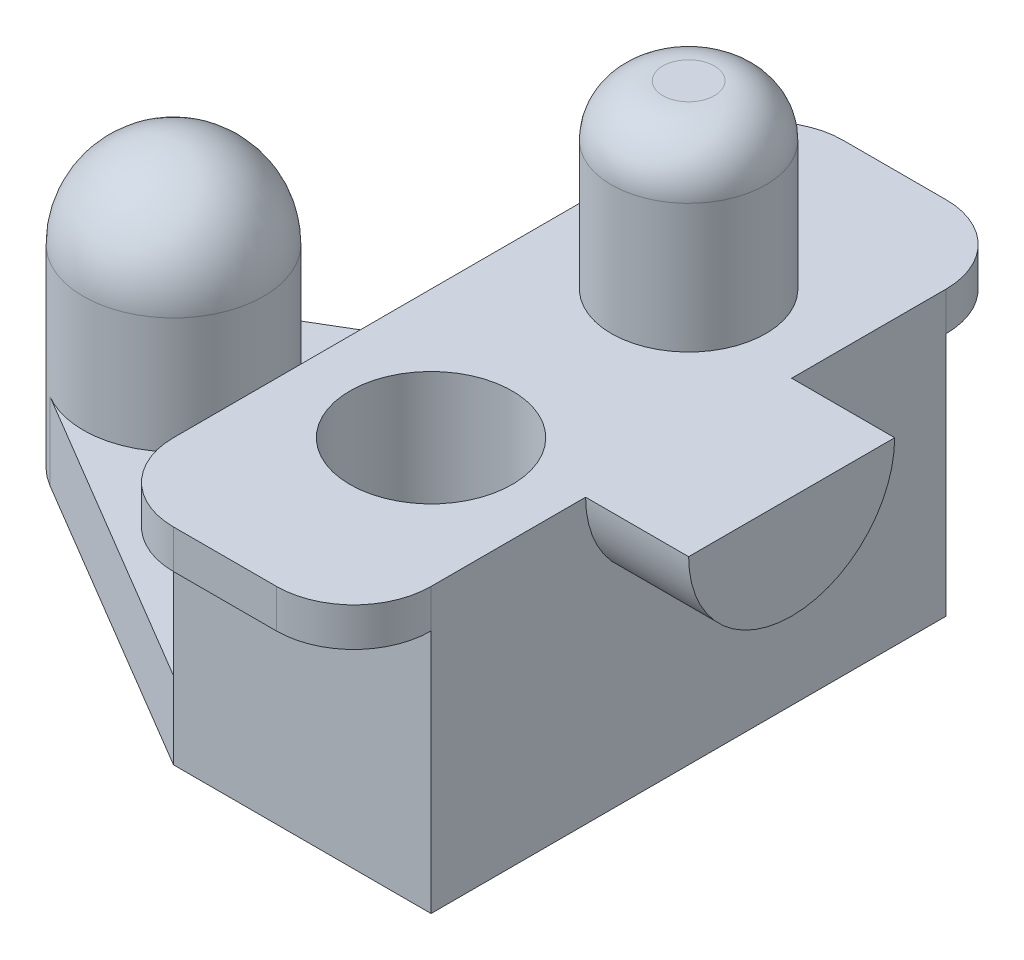
from build123d import *
from build123d.topology import SkipClean

# Parameters (mm, degrees)
BOSS_EXTRUDE1_DEPTH = 1.5
BOSS_EXTRUDE2_START = 4
SKETCH2_R           = 1.75
SKETCH2_W           = 5
SKETCH2_H           = 10
BOSS_EXTRUDE2_DEPTH = 4
BOSS_EXTRUDE3_DEPTH = 0.75
FILLET1_R           = 1.75
SKETCH4_R           = 1.5
BOSS_EXTRUDE4_DEPTH = 3.5
FILLET2_R           = 1
SKETCH5_R           = 1.575
CUT_EXTRUDE1_DEPTH  = 3.75
BOSS_EXTRUDE5_DEPTH = 2


with BuildPart() as part:
    # Sketch1 → Boss-Extrude1 (new body)
    with BuildSketch(Plane(origin=(0, 0, 0), x_dir=(1, 0, 0), z_dir=(0, 1, 0))):
        with BuildLine():
            Line((5, 5), (10, 5))
            Line((10, 5), (10, -5))
            Line((10, -5), (5, -5))
            Line((5, -5), (-0.892692, -1.505192))
            ThreePointArc((-0.892692, -1.505192), (-1.75, 0), (-0.892692, 1.505192))
            Line((-0.892692, 1.505192), (5, 5))
        make_face()
    extrude(amount=-BOSS_EXTRUDE1_DEPTH)

    # Sketch2 → Boss-Extrude2 (add)
    with SkipClean():  # the faces are left unmerged after this step: merging them gives an invalid solid
        with BuildSketch(Plane(origin=(0, 0, 0), x_dir=(1, 0, 0), z_dir=(0, 1, 0)).offset(BOSS_EXTRUDE2_START)):
            Circle(SKETCH2_R)
            with Locations((7.5, 0)):
                Rectangle(SKETCH2_W, SKETCH2_H)
        extrude(amount=-BOSS_EXTRUDE2_DEPTH)

    # Sketch3 → Boss-Extrude3 (add)
    with SkipClean():  # the faces are left unmerged after this step: merging them gives an invalid solid
        with BuildSketch(Plane(origin=(0, 4, 0), x_dir=(1, 0, 0), z_dir=(0, 1, 0))):
            with BuildLine():
                Line((5, 5), (10, 5))
                ThreePointArc((10, 5), (9.56066, 6.06066), (8.5, 6.5))
                Line((8.5, 6.5), (6.5, 6.5))
                ThreePointArc((6.5, 6.5), (5.43934, 6.06066), (5, 5))
            make_face()
            with BuildLine():
                Line((6.5, -6.5), (8.5, -6.5))
                ThreePointArc((8.5, -6.5), (9.56066, -6.06066), (10, -5))
                Line((10, -5), (5, -5))
                ThreePointArc((5, -5), (5.43934, -6.06066), (6.5, -6.5))
            make_face()
        extrude(amount=-BOSS_EXTRUDE3_DEPTH)

    # Fillet1
    fillet1_edges = [part.edges().sort_by_distance(p)[0] for p in [
        (-1.75, 4, 0),
    ]]
    fillet(fillet1_edges, radius=FILLET1_R)

    # Sketch4 → Boss-Extrude4 (add)
    with SkipClean():  # the faces are left unmerged after this step: merging them gives an invalid solid
        with BuildSketch(Plane(origin=(0, 4, 0), x_dir=(1, 0, 0), z_dir=(0, 1, 0))):
            with Locations((7.5, 2.5)):
                Circle(SKETCH4_R)
        extrude(amount=BOSS_EXTRUDE4_DEPTH)

    # Fillet2
    fillet2_edges = [part.edges().sort_by_distance(p)[0] for p in [
        (6, 7.5, -2.5),
    ]]
    fillet(fillet2_edges, radius=FILLET2_R)

    # Sketch5 → Cut-Extrude1 (cut)
    with SkipClean():  # the faces are left unmerged after this step: merging them gives an invalid solid
        with BuildSketch(Plane(origin=(0, 4, 0), x_dir=(1, 0, 0), z_dir=(0, 1, 0))):
            with Locations((7.5, -2.5)):
                Circle(SKETCH5_R)
        extrude(amount=-CUT_EXTRUDE1_DEPTH, mode=Mode.SUBTRACT)

    # Sketch6 → Boss-Extrude5 (add)
    with SkipClean():  # the faces are left unmerged after this step: merging them gives an invalid solid
        with BuildSketch(Plane(origin=(10, 0, 0), x_dir=(0, 0, -1), z_dir=(1, 0, 0))):
            with BuildLine():
                Line((-2, 4), (2, 4))
                ThreePointArc((2, 4), (0, 2), (-2, 4))
            make_face()
        extrude(amount=BOSS_EXTRUDE5_DEPTH)


solid = part.part
